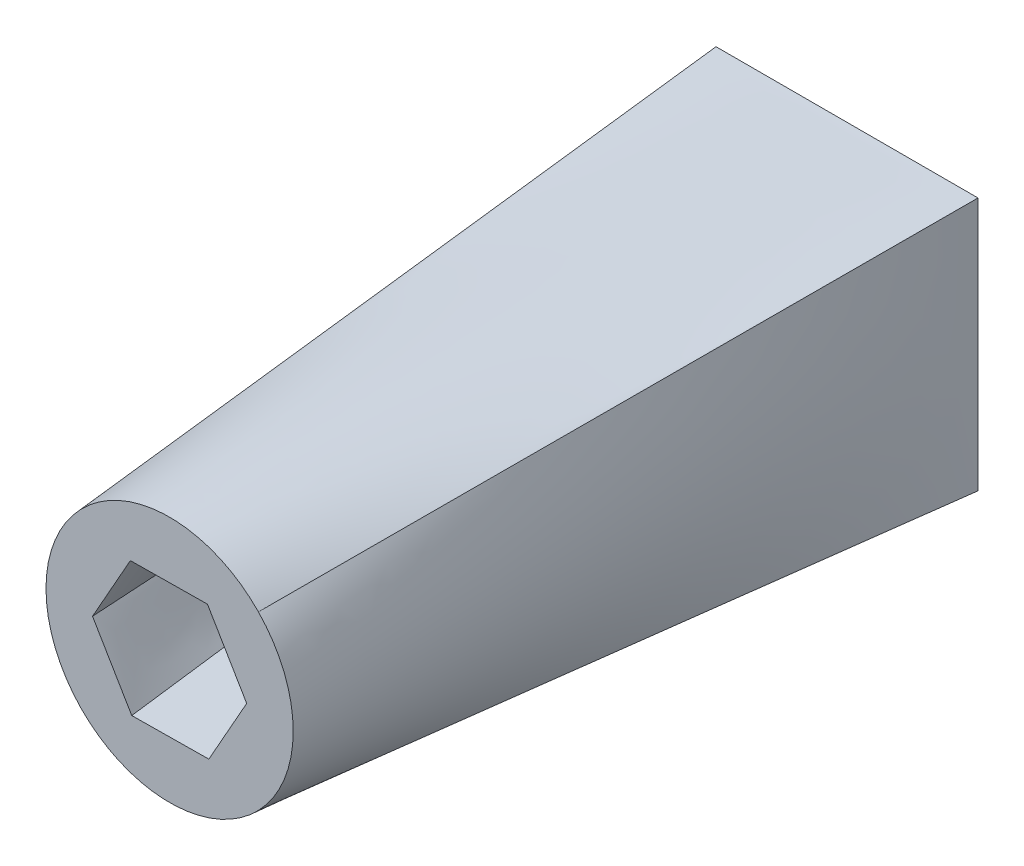
from build123d import *


with BuildPart() as part:
    # Esquisse2 → Lissage1 section 0
    with BuildSketch(Plane.XY):
        with BuildLine():
            Line((-38.674883287, 37.442595339), (38.674883287, 37.442595339))
            Line((38.674883287, 37.442595339), (38.674883287, -37.442595339))
            Line((38.674883287, -37.442595339), (-38.674883287, -37.442595339))
            Line((-38.674883287, -37.442595339), (-38.674883287, 37.442595339))
        make_face()
    # Esquisse1 for Lissage1 → Lissage1 section 1
    with BuildSketch(Plane.XY.offset(200)):
        with BuildLine():
            # circular arc as an exact rational Bezier (weights 1, cos(half-angle), 1)
            Bezier((-26.219975918, 25.384535509), (0, 52.467447345), (26.219975918, 25.384535509), weights=[1, 0.695568078, 1])
            Bezier((26.219975918, 25.384535509), (50.795690445, 0), (26.219975918, -25.384535509), weights=[1, 0.718460192, 1])
            Bezier((26.219975918, -25.384535509), (0, -52.467447345), (-26.219975918, -25.384535509), weights=[1, 0.695568078, 1])
            Bezier((-26.219975918, -25.384535509), (-50.795690445, 0), (-26.219975918, 25.384535509), weights=[1, 0.718460192, 1])
        make_face()
    loft()

    # Enlèvement de matière-Lissage1: read off the stored shape, not the designer's step
    # Enlèvement de matière-Lissage1: loft between two sections, ruled curve by curve
    enl_vement_de_mati_re_lissage1_from = [
        Edge.make_bspline([(-22.758559894, -0.236750535, 200), (-20.896185232, 3.067893847, 200), (-19.033810571, 6.372538228, 200), (-15.309061247, 12.981826991, 200), (-13.446686586, 16.286471373, 200), (-11.584311924, 19.591115754, 200)], [0, 0, 0, 0, 0.5, 0.5, 1, 1, 1, 1], 3),
        Edge.make_bspline([(-11.584311924, 19.591115754, 200), (-7.791218609, 19.630574177, 200), (-3.998125293, 19.670032599, 200), (3.588061338, 19.748949444, 200), (7.381154654, 19.788407866, 200), (11.174247969, 19.827866289, 200)], [0, 0, 0, 0, 0.5, 0.5, 1, 1, 1, 1], 3),
        Edge.make_bspline([(-11.174247969, -19.827866289, 200), (-11.415587801, -19.419718044, 200), (-11.656927633, -19.011569799, 200), (-12.139607297, -18.195273309, 200), (-12.380947128, -17.787125064, 200), (-12.863626792, -16.970828575, 200), (-13.104966624, -16.56268033, 200), (-13.587646287, -15.74638384, 200), (-13.828986119, -15.338235595, 200), (-14.311665782, -14.521939105, 200), (-14.553005614, -14.113790861, 200), (-15.035685278, -13.297494371, 200), (-15.277025109, -12.889346126, 200), (-15.759704773, -12.073049636, 200), (-16.001044605, -11.664901391, 200), (-16.483724268, -10.848604901, 200), (-16.7250641, -10.440456657, 200), (-17.207743763, -9.624160167, 200), (-17.449083595, -9.216011922, 200), (-17.931763259, -8.399715432, 200), (-18.17310309, -7.991567187, 200), (-18.655782754, -7.175270698, 200), (-18.897122586, -6.767122453, 200), (-19.379802249, -5.950825963, 200), (-19.621142081, -5.542677718, 200), (-20.103821744, -4.726381228, 200), (-20.345161576, -4.318232983, 200), (-20.82784124, -3.501936494, 200), (-21.069181071, -3.093788249, 200), (-21.551860735, -2.277491759, 200), (-21.793200567, -1.869343514, 200), (-22.27588023, -1.053047024, 200), (-22.517220062, -0.64489878, 200), (-22.758559894, -0.236750535, 200)], [0, 0, 0, 0, 0.0625, 0.0625, 0.125, 0.125, 0.1875, 0.1875, 0.25, 0.25, 0.3125, 0.3125, 0.375, 0.375, 0.4375, 0.4375, 0.5, 0.5, 0.5625, 0.5625, 0.625, 0.625, 0.6875, 0.6875, 0.75, 0.75, 0.8125, 0.8125, 0.875, 0.875, 0.9375, 0.9375, 1, 1, 1, 1], 3),
        Edge.make_bspline([(11.174247969, 19.827866289, 200), (11.415587801, 19.419718044, 200), (11.656927633, 19.011569799, 200), (12.139607297, 18.195273309, 200), (12.380947128, 17.787125064, 200), (12.863626792, 16.970828575, 200), (13.104966624, 16.56268033, 200), (13.587646287, 15.74638384, 200), (13.828986119, 15.338235595, 200), (14.311665782, 14.521939105, 200), (14.553005614, 14.113790861, 200), (15.035685278, 13.297494371, 200), (15.277025109, 12.889346126, 200), (15.759704773, 12.073049636, 200), (16.001044605, 11.664901391, 200), (16.483724268, 10.848604901, 200), (16.7250641, 10.440456657, 200), (17.207743763, 9.624160167, 200), (17.449083595, 9.216011922, 200), (17.931763259, 8.399715432, 200), (18.17310309, 7.991567187, 200), (18.655782754, 7.175270698, 200), (18.897122586, 6.767122453, 200), (19.379802249, 5.950825963, 200), (19.621142081, 5.542677718, 200), (20.103821744, 4.726381228, 200), (20.345161576, 4.318232983, 200), (20.82784124, 3.501936494, 200), (21.069181071, 3.093788249, 200), (21.551860735, 2.277491759, 200), (21.793200567, 1.869343514, 200), (22.27588023, 1.053047024, 200), (22.517220062, 0.64489878, 200), (22.758559894, 0.236750535, 200)], [0, 0, 0, 0, 0.0625, 0.0625, 0.125, 0.125, 0.1875, 0.1875, 0.25, 0.25, 0.3125, 0.3125, 0.375, 0.375, 0.4375, 0.4375, 0.5, 0.5, 0.5625, 0.5625, 0.625, 0.625, 0.6875, 0.6875, 0.75, 0.75, 0.8125, 0.8125, 0.875, 0.875, 0.9375, 0.9375, 1, 1, 1, 1], 3),
        Edge.make_bspline([(22.758559894, 0.236750535, 200), (20.896185232, -3.067893847, 200), (19.033810571, -6.372538228, 200), (15.309061247, -12.981826991, 200), (13.446686586, -16.286471373, 200), (11.584311924, -19.591115754, 200)], [0, 0, 0, 0, 0.5, 0.5, 1, 1, 1, 1], 3),
        Edge.make_bspline([(11.584311924, -19.591115754, 200), (7.791218609, -19.630574177, 200), (3.998125293, -19.670032599, 200), (-3.588061338, -19.748949444, 200), (-7.381154654, -19.788407866, 200), (-11.174247969, -19.827866289, 200)], [0, 0, 0, 0, 0.5, 0.5, 1, 1, 1, 1], 3),
    ]
    enl_vement_de_mati_re_lissage1_to = [
        Edge.make_bspline([(-26.235059358, 8.801805629, 0), (-21.928799615, 8.801805629, 0), (-17.622539872, 8.801805629, 0), (-9.010020385, 8.801805629, 0), (-4.703760642, 8.801805629, 0), (-0.397500899, 8.801805629, 0)], [0, 0, 0, 0, 0.5, 0.5, 1, 1, 1, 1], 3),
        Edge.make_bspline([(-0.397500899, 8.801805629, 0), (3.908758844, 8.801805629, 0), (8.215018587, 8.801805629, 0), (16.827538073, 8.801805629, 0), (21.133797816, 8.801805629, 0), (25.440057559, 8.801805629, 0)], [0, 0, 0, 0, 0.5, 0.5, 1, 1, 1, 1], 3),
        Edge.make_bspline([(-26.235059358, -8.801805629, 0), (-26.601801259, -8.801805629, 0), (-26.991692504, -8.779058383, 0), (-27.815188768, -8.668768704, 0), (-28.248912486, -8.581173701, 0), (-29.150217382, -8.318293106, 0), (-29.617918879, -8.142864745, 0), (-30.566141848, -7.680606048, 0), (-31.046713101, -7.393516728, 0), (-31.985572368, -6.689372278, 0), (-32.44372653, -6.271981593, 0), (-33.289386969, -5.302995672, 0), (-33.676493644, -4.751147675, 0), (-34.32622324, -3.532904681, 0), (-34.588268029, -2.866576224, 0), (-34.943812367, -1.466620394, 0), (-35.036864986, -0.733483802, 0), (-35.036864986, 0.733483802, 0), (-34.943812367, 1.466620394, 0), (-34.588268029, 2.866576224, 0), (-34.32622324, 3.532904681, 0), (-33.676493644, 4.751147675, 0), (-33.289386969, 5.302995672, 0), (-32.44372653, 6.271981593, 0), (-31.985572368, 6.689372278, 0), (-31.046713101, 7.393516728, 0), (-30.566141848, 7.680606048, 0), (-29.617918879, 8.142864745, 0), (-29.150217382, 8.318293106, 0), (-28.248912486, 8.581173701, 0), (-27.815188768, 8.668768704, 0), (-26.991692504, 8.779058383, 0), (-26.601801259, 8.801805629, 0), (-26.235059358, 8.801805629, 0)], [0, 0, 0, 0, 0.0625, 0.0625, 0.125, 0.125, 0.1875, 0.1875, 0.25, 0.25, 0.3125, 0.3125, 0.375, 0.375, 0.4375, 0.4375, 0.5, 0.5, 0.5625, 0.5625, 0.625, 0.625, 0.6875, 0.6875, 0.75, 0.75, 0.8125, 0.8125, 0.875, 0.875, 0.9375, 0.9375, 1, 1, 1, 1], 3),
        Edge.make_bspline([(25.440057559, 8.801805629, 0), (25.80679946, 8.801805629, 0), (26.196690705, 8.779058383, 0), (27.020186969, 8.668768704, 0), (27.453910687, 8.581173701, 0), (28.355215583, 8.318293106, 0), (28.82291708, 8.142864745, 0), (29.771140049, 7.680606048, 0), (30.251711303, 7.393516728, 0), (31.19057057, 6.689372278, 0), (31.648724731, 6.271981593, 0), (32.49438517, 5.302995672, 0), (32.881491845, 4.751147675, 0), (33.531221441, 3.532904681, 0), (33.79326623, 2.866576224, 0), (34.148810568, 1.466620394, 0), (34.241863188, 0.733483802, 0), (34.241863188, -0.733483802, 0), (34.148810568, -1.466620394, 0), (33.79326623, -2.866576224, 0), (33.531221441, -3.532904681, 0), (32.881491845, -4.751147675, 0), (32.49438517, -5.302995672, 0), (31.648724731, -6.271981593, 0), (31.19057057, -6.689372278, 0), (30.251711303, -7.393516728, 0), (29.771140049, -7.680606048, 0), (28.82291708, -8.142864745, 0), (28.355215583, -8.318293106, 0), (27.453910687, -8.581173701, 0), (27.020186969, -8.668768704, 0), (26.196690705, -8.779058383, 0), (25.80679946, -8.801805629, 0), (25.440057559, -8.801805629, 0)], [0, 0, 0, 0, 0.0625, 0.0625, 0.125, 0.125, 0.1875, 0.1875, 0.25, 0.25, 0.3125, 0.3125, 0.375, 0.375, 0.4375, 0.4375, 0.5, 0.5, 0.5625, 0.5625, 0.625, 0.625, 0.6875, 0.6875, 0.75, 0.75, 0.8125, 0.8125, 0.875, 0.875, 0.9375, 0.9375, 1, 1, 1, 1], 3),
        Edge.make_bspline([(25.440057559, -8.801805629, 0), (21.133797816, -8.801805629, 0), (16.827538073, -8.801805629, 0), (8.215018587, -8.801805629, 0), (3.908758844, -8.801805629, 0), (-0.397500899, -8.801805629, 0)], [0, 0, 0, 0, 0.5, 0.5, 1, 1, 1, 1], 3),
        Edge.make_bspline([(-0.397500899, -8.801805629, 0), (-4.703760642, -8.801805629, 0), (-9.010020385, -8.801805629, 0), (-17.622539872, -8.801805629, 0), (-21.928799615, -8.801805629, 0), (-26.235059358, -8.801805629, 0)], [0, 0, 0, 0, 0.5, 0.5, 1, 1, 1, 1], 3),
    ]
    enl_vement_de_mati_re_lissage1 = Solid(Shell([*[Face.make_surface_from_curves(enl_vement_de_mati_re_lissage1_from[k], enl_vement_de_mati_re_lissage1_to[k]) for k in range(6)], Face(Wire(enl_vement_de_mati_re_lissage1_from)), Face(Wire(enl_vement_de_mati_re_lissage1_to))]))
    add(enl_vement_de_mati_re_lissage1, mode=Mode.SUBTRACT)


solid = part.part
